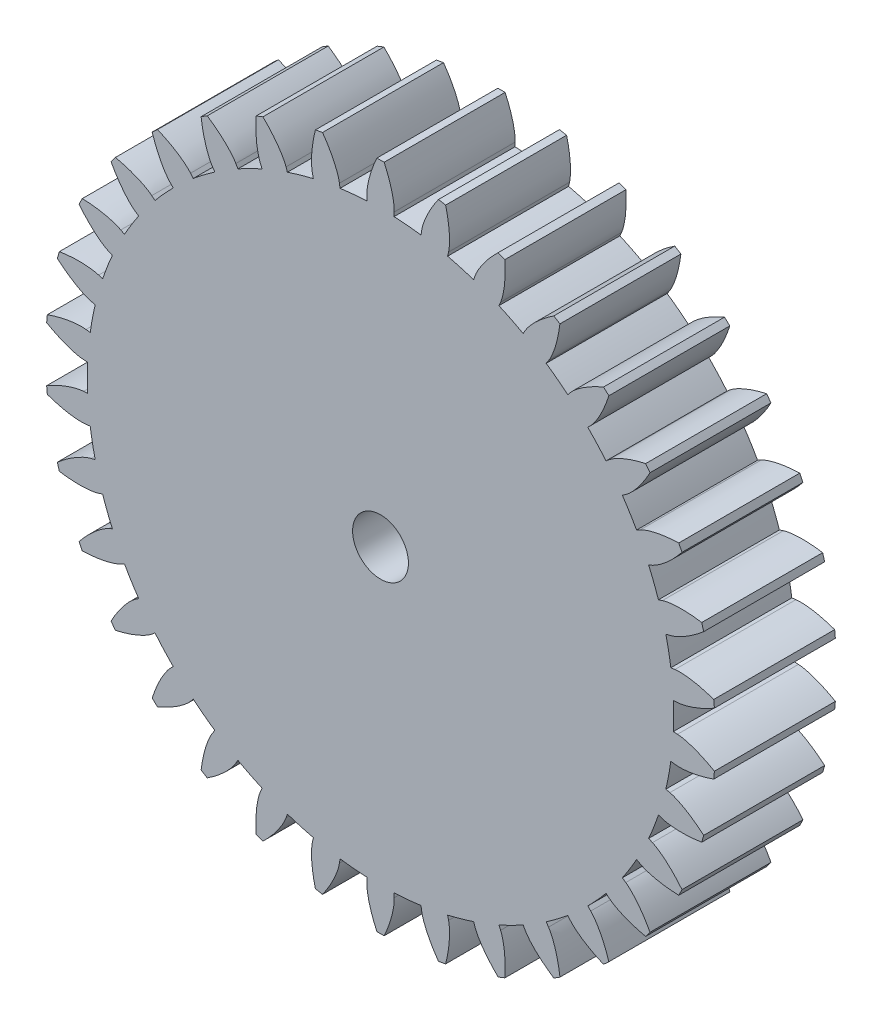
from build123d import *

# Parameters (mm, degrees)
SKETCH_1_R               = 4
SKETCH_1_R_2             = 1.5
EXTRUDE_1_DEPTH          = 6
CUT_EXTRUDE_1_DEPTH      = 9.246211251
PATTERN_CIRCULAR_1_COUNT = 6
PATTERN_CIRCULAR_1_ANGLE = 300
SKETCH_2_R               = 18
SKETCH_2_R_2             = 1.5
EXTRUDE_2_DEPTH          = 6.5
CUT_EXTRUDE_3_DEPTH      = 27.272609448
PATTERN_CIRCULAR_2_COUNT = 34


with BuildPart() as part:
    # 草图1 → 凸台-拉伸1 (new body)
    with BuildSketch(Plane.XY):
        Circle(SKETCH_1_R)
        Circle(SKETCH_1_R_2, mode=Mode.SUBTRACT)
    extrude(amount=EXTRUDE_1_DEPTH)

    # 草图1<3> → 切除-拉伸1 (cut, through all)
    with BuildSketch(Plane.XY):
        with BuildLine():
            Line((2.730540893, 0.700961074), (1.695038873, 0.435135863))
            ThreePointArc((1.695038873, 0.435135863), (1.736205349, 0.219296571), (1.75, 0))
            ThreePointArc((1.75, 0), (1.736205349, -0.219296571), (1.695038873, -0.435135863))
            Line((1.695038873, -0.435135863), (2.730540893, -0.700961074))
            add(Edge.make_bspline(
                [(2.730540893, -0.700961074), (2.751355068, -0.706304311), (2.808329953, -0.725541446), (2.910522768, -0.778982289), (3.06267796, -0.887491262), (3.235956594, -1.057334282), (3.408810129, -1.2831446), (3.52264255, -1.482702951), (3.589508983, -1.625182096), (3.620975996, -1.699568426)],
                knots=[0, 0, 0, 0, 0, 0.005604068, 0.015718248, 0.029959916, 0.048733667, 0.068727063, 0.089838728, 0.089838728, 0.089838728, 0.089838728, 0.089838728], degree=4))
            ThreePointArc((3.620975996, -1.699568426), (3.90409426, -0.870659525), (4, 0))
            ThreePointArc((4, 0), (3.90409426, 0.870659525), (3.620975996, 1.699568426))
            add(Edge.make_bspline(
                [(2.730540893, 0.700961074), (2.751355068, 0.706304311), (2.808329953, 0.725541446), (2.910522768, 0.778982289), (3.06267796, 0.887491262), (3.235956594, 1.057334282), (3.408810129, 1.2831446), (3.52264255, 1.482702951), (3.589508983, 1.625182096), (3.620975996, 1.699568426)],
                knots=[0, 0, 0, 0, 0, 0.005604068, 0.015718248, 0.029959916, 0.048733667, 0.068727063, 0.089838728, 0.089838728, 0.089838728, 0.089838728, 0.089838728], degree=4))
        make_face()
    cut_extrude_1 = extrude(amount=CUT_EXTRUDE_1_DEPTH, mode=Mode.SUBTRACT)

    # 阵列(圆周)1: 切除-拉伸1 ×6 about axis
    pattern_circular_1_axis = Axis((0, 0, 6), (0, 0, 1))
    for i in range(1, PATTERN_CIRCULAR_1_COUNT):
        add(cut_extrude_1.rotate(pattern_circular_1_axis, i * PATTERN_CIRCULAR_1_ANGLE / (PATTERN_CIRCULAR_1_COUNT - 1)), mode=Mode.SUBTRACT)

    # 草图2 → 凸台-拉伸2 (add)
    with BuildSketch(Plane.XY.offset(6)):
        Circle(SKETCH_2_R)
        Circle(SKETCH_2_R_2, mode=Mode.SUBTRACT)
    extrude(amount=EXTRUDE_2_DEPTH)

    # 草图2<3> → 切除-拉伸3 (cut, through all)
    with BuildSketch(Plane.XY.offset(6)):
        with BuildLine():
            Line((15.957729066, 0.73777034), (15.733194353, 0.727389474))
            ThreePointArc((15.733194353, 0.727389474), (15.745798028, 0.363791794), (15.75, 0))
            ThreePointArc((15.75, 0), (15.745798028, -0.363791794), (15.733194353, -0.727389474))
            Line((15.733194353, -0.727389474), (15.957729066, -0.73777034))
            add(Edge.make_bspline(
                [(15.957729066, -0.73777034), (15.988091187, -0.739174066), (16.048646162, -0.743843856), (16.169079717, -0.760517936), (16.395739934, -0.806506325), (16.694781917, -0.890894302), (17.137677277, -1.05344044), (17.509473515, -1.228645323), (17.774574498, -1.371275407), (17.940116406, -1.467045792)],
                knots=[0, 0, 0, 0, 0, 0.001401017, 0.002802034, 0.005604068, 0.010661158, 0.015718248, 0.024539686, 0.024539686, 0.024539686, 0.024539686, 0.024539686], degree=4))
            ThreePointArc((17.940116406, -1.467045792), (17.98502287, -0.734133741), (18, 0))
            ThreePointArc((18, 0), (17.98502287, 0.734133741), (17.940116406, 1.467045792))
            add(Edge.make_bspline(
                [(15.957729066, 0.73777034), (15.988091187, 0.739174066), (16.048646162, 0.743843856), (16.169079717, 0.760517936), (16.395739934, 0.806506325), (16.694781917, 0.890894302), (17.137677277, 1.05344044), (17.509473515, 1.228645323), (17.774574498, 1.371275407), (17.940116406, 1.467045792)],
                knots=[0, 0, 0, 0, 0, 0.001401017, 0.002802034, 0.005604068, 0.010661158, 0.015718248, 0.024539686, 0.024539686, 0.024539686, 0.024539686, 0.024539686], degree=4))
        make_face()
    cut_extrude_3 = extrude(amount=CUT_EXTRUDE_3_DEPTH, mode=Mode.SUBTRACT)

    # 阵列(圆周)2: 切除-拉伸3 ×34 about axis
    pattern_circular_2_axis = Axis((0, 0, 12.5), (0, 0, 1))
    for i in range(1, PATTERN_CIRCULAR_2_COUNT):
        add(cut_extrude_3.rotate(pattern_circular_2_axis, i * 360 / PATTERN_CIRCULAR_2_COUNT), mode=Mode.SUBTRACT)


solid = part.part
